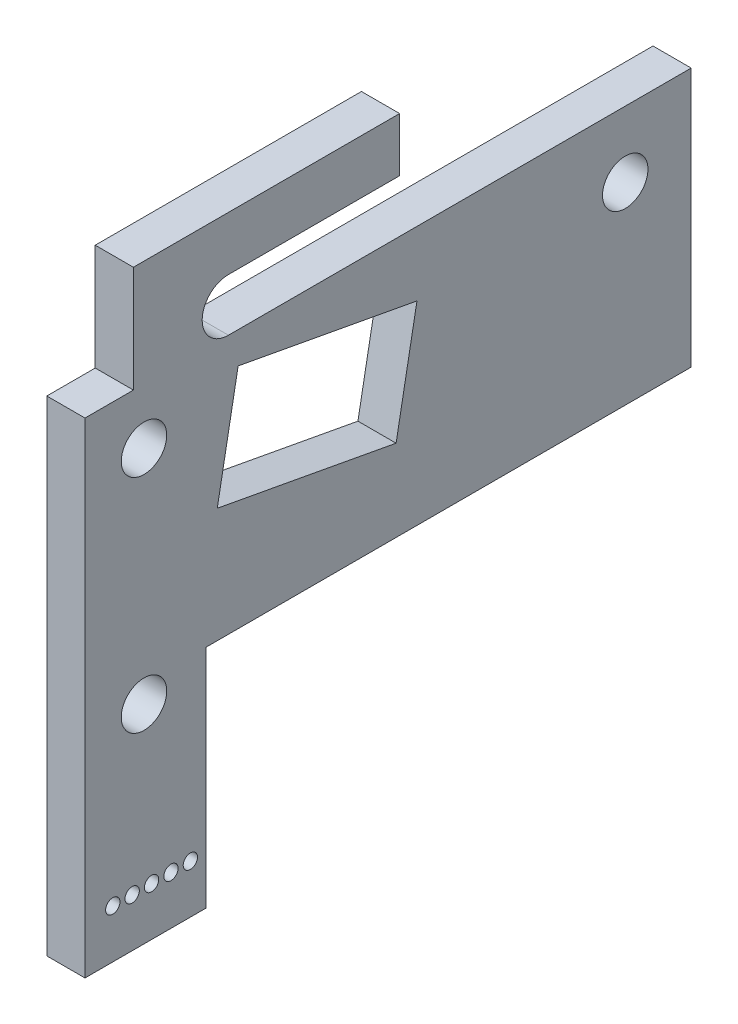
from build123d import *

# Parameters (mm, degrees)
SKETCH1_R           = 2.38125
SKETCH1_R_2         = 0.75
BOSS_EXTRUDE1_DEPTH = 2


with BuildPart() as part:
    # Sketch1 → Boss-Extrude1 (new, symmetric)
    with BuildSketch(Plane(origin=(0, 0, 0), x_dir=(0, 0, -1), z_dir=(1, 0, 0))):
        with BuildLine():
            Line((-56.590412722, 6.909587278), (-51.518608779, 6.909587278))
            Line((-51.518608779, 6.909587278), (-51.518608779, 18.053715602))
            Line((-51.518608779, 18.053715602), (-23.630785684, 18.053715602))
            Line((-23.630785684, 18.053715602), (-23.630785684, 12.411943906))
            Line((-23.630785684, 12.411943906), (-41.565323323, 12.411943906))
            ThreePointArc((-41.565323323, 12.411943906), (-44.316501637, 9.660765592), (-41.565323323, 6.909587278))
            Line((-41.565323323, 6.909587278), (6.909587278, 6.909587278))
            Line((6.909587278, 6.909587278), (6.909587278, -20.222057583))
            Line((6.909587278, -20.222057583), (-43.890412722, -20.222057583))
            Line((-43.890412722, -20.222057583), (-43.890412722, -43.890412722))
            Line((-43.890412722, -43.890412722), (-56.590412722, -43.890412722))
            Line((-56.590412722, -43.890412722), (-56.590412722, 6.909587278))
        make_face()
        Circle(SKETCH1_R, mode=Mode.SUBTRACT)
        with Locations((-45.552958224, -38.810412722)):
            Circle(SKETCH1_R_2, mode=Mode.SUBTRACT)
        with Locations((-47.584958224, -38.810412722)):
            Circle(SKETCH1_R_2, mode=Mode.SUBTRACT)
        with Locations((-49.616958224, -38.810412722)):
            Circle(SKETCH1_R_2, mode=Mode.SUBTRACT)
        with Locations((-51.648958224, -38.810412722)):
            Circle(SKETCH1_R_2, mode=Mode.SUBTRACT)
        with Locations((-50.410128911, -22.137211246)):
            Circle(SKETCH1_R, mode=Mode.SUBTRACT)
        with Locations((-50.410128911, 1.079375692)):
            Circle(SKETCH1_R, mode=Mode.SUBTRACT)
        with Locations((-53.680958224, -38.810412722)):
            Circle(SKETCH1_R_2, mode=Mode.SUBTRACT)
        Polygon((-40.547855017, 3.612408172), (-21.81561352, 0.147494252), (-24.001169646, -11.668200482), (-42.733411143, -8.203286562), align=None, mode=Mode.SUBTRACT)
    extrude(amount=BOSS_EXTRUDE1_DEPTH, both=True)


solid = part.part
